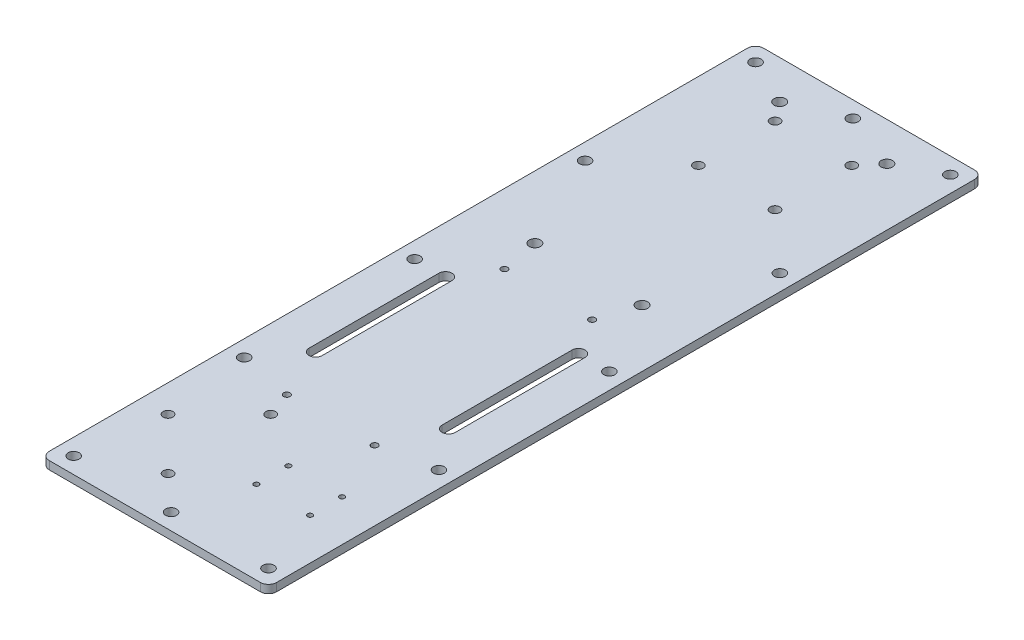
from build123d import *

# Parameters (mm, degrees)
PLATE_THICKNESS_DEPTH        = 3.175
SKETCH3_R                    = 2.159
MOUNTING_HOLES_DEPTH         = 147.635511132
SKETCH4_R                    = 2.2225
JETSON_HOLES_W_MOUNT_DEPTH   = 147.635511132
SKETCH5_R                    = 1.905
PDB_HOLES_DEPTH              = 147.635511132
SKETCH6_R                    = 1.905
LIDAR_HOLES_DEPTH            = 147.635511132
SKETCH7_R                    = 1.27
PIXHAWK_HOLES_DEPTH          = 147.635511132
BATTERY_HOLES_DEPTH          = 147.635511132
SKETCH9_R                    = 1
VENTRAL_BOARDCAM_HOLES_DEPTH = 147.635511132


with BuildPart() as part:
    # Sketch2 → Plate Thickness (new body)
    with BuildSketch(Plane(origin=(0, 0, 0), x_dir=(1, 0, 0), z_dir=(0, 1, 0))):
        with BuildLine():
            Line((-41.275, 139.7), (41.275, 139.7))
            ThreePointArc((41.275, 139.7), (43.52006403, 138.77006403), (44.45, 136.525))
            Line((44.45, 136.525), (44.45, -136.525))
            ThreePointArc((44.45, -136.525), (43.52006403, -138.77006403), (41.275, -139.7))
            Line((41.275, -139.7), (-41.275, -139.7))
            ThreePointArc((-41.275, -139.7), (-43.52006403, -138.77006403), (-44.45, -136.525))
            Line((-44.45, -136.525), (-44.45, 136.525))
            ThreePointArc((-44.45, 136.525), (-43.52006403, 138.77006403), (-41.275, 139.7))
        make_face()
    extrude(amount=PLATE_THICKNESS_DEPTH)

    # Sketch3 → Mounting holes (cut, through all)
    with BuildSketch(Plane(origin=(0, 3.175, 0), x_dir=(1, 0, 0), z_dir=(0, 1, 0))):
        with Locations((-38.1, 133.35)):
            Circle(SKETCH3_R)
        with Locations((-38.1, 66.675)):
            Circle(SKETCH3_R)
        with Locations((-38.1, -66.675)):
            Circle(SKETCH3_R)
        with Locations((-38.1, -133.35)):
            Circle(SKETCH3_R)
        with Locations((38.1, -133.35)):
            Circle(SKETCH3_R)
        with Locations((38.1, -66.675)):
            Circle(SKETCH3_R)
        with Locations((38.1, 66.675)):
            Circle(SKETCH3_R)
        with Locations((38.1, 133.35)):
            Circle(SKETCH3_R)
        with Locations((0, 133.35)):
            Circle(SKETCH3_R)
        with Locations((0, -133.35)):
            Circle(SKETCH3_R)
        with Locations((-38.1, 0)):
            Circle(SKETCH3_R)
        with Locations((38.1, 0)):
            Circle(SKETCH3_R)
    extrude(amount=-MOUNTING_HOLES_DEPTH, mode=Mode.SUBTRACT)

    # Sketch4 → Jetson Holes (w/ mount) (cut, through all)
    with BuildSketch(Plane(origin=(0, 3.175, 0), x_dir=(1, 0, 0), z_dir=(0, 1, 0))):
        with Locations((-19.937372124, 124.652240808)):
            Circle(SKETCH4_R)
        with Locations((-19.937372124, 28.894240808)):
            Circle(SKETCH4_R)
        with Locations((21.972627876, 28.894240808)):
            Circle(SKETCH4_R)
        with Locations((21.972627876, 124.652240808)):
            Circle(SKETCH4_R)
    extrude(amount=-JETSON_HOLES_W_MOUNT_DEPTH, mode=Mode.SUBTRACT)

    # Sketch5 → PDB holes (cut, through all)
    with BuildSketch(Plane(origin=(0, 3.175, 0), x_dir=(1, 0, 0), z_dir=(0, 1, 0))):
        with Locations((-14.341868752, 117.235149692)):
            Circle(SKETCH5_R)
        with Locations((15.655531248, 117.235149692)):
            Circle(SKETCH5_R)
        with Locations((15.655531248, 87.237749692)):
            Circle(SKETCH5_R)
        with Locations((-14.341868752, 87.237749692)):
            Circle(SKETCH5_R)
    extrude(amount=-PDB_HOLES_DEPTH, mode=Mode.SUBTRACT)

    # Sketch6 → Lidar Holes (cut, through all)
    with BuildSketch(Plane(origin=(0, 3.175, 0), x_dir=(1, 0, 0), z_dir=(0, 1, 0))):
        with Locations((-13.662214462, -120.878432291)):
            Circle(SKETCH6_R)
        with Locations((-13.662214462, -80.746432291)):
            Circle(SKETCH6_R)
        with Locations((-33.728214462, -100.812432291)):
            Circle(SKETCH6_R)
    extrude(amount=-LIDAR_HOLES_DEPTH, mode=Mode.SUBTRACT)

    # Sketch7 → PixHawk Holes (cut, through all)
    with BuildSketch(Plane(origin=(0, 3.175, 0), x_dir=(1, 0, 0), z_dir=(0, 1, 0))):
        with Locations((-17.145, 14.172396373)):
            Circle(SKETCH7_R)
        with Locations((-17.145, -70.917603627)):
            Circle(SKETCH7_R)
        with Locations((17.145, -70.917603627)):
            Circle(SKETCH7_R)
        with Locations((17.145, 14.172396373)):
            Circle(SKETCH7_R)
    extrude(amount=-PIXHAWK_HOLES_DEPTH, mode=Mode.SUBTRACT)

    # Sketch8 → Battery Holes (cut, through all)
    with BuildSketch(Plane(origin=(0, 3.175, 0), x_dir=(1, 0, 0), z_dir=(0, 1, 0))):
        with BuildLine():
            Line((-23.495, -0.005964701), (-23.495, -50.805964701))
            ThreePointArc((-23.495, -50.805964701), (-26.035, -53.345964701), (-28.575, -50.805964701))
            Line((-28.575, -50.805964701), (-28.575, -0.005964701))
            ThreePointArc((-28.575, -0.005964701), (-26.035, 2.534035299), (-23.495, -0.005964701))
        make_face()
        with BuildLine():
            Line((23.495, -0.005964701), (23.495, -50.805964701))
            ThreePointArc((23.495, -50.805964701), (26.035, -53.345964701), (28.575, -50.805964701))
            Line((28.575, -50.805964701), (28.575, -0.005964701))
            ThreePointArc((28.575, -0.005964701), (26.035, 2.534035299), (23.495, -0.005964701))
        make_face()
    extrude(amount=-BATTERY_HOLES_DEPTH, mode=Mode.SUBTRACT)

    # Sketch9 → Ventral Boardcam Holes (cut, through all)
    with BuildSketch(Plane.XZ):
        with Locations((7.243059032, 107.226883851)):
            Circle(SKETCH9_R)
        with Locations((28.243059032, 107.226883851)):
            Circle(SKETCH9_R)
        with Locations((7.243059032, 94.726883851)):
            Circle(SKETCH9_R)
        with Locations((28.243059032, 94.726883851)):
            Circle(SKETCH9_R)
    extrude(amount=-VENTRAL_BOARDCAM_HOLES_DEPTH, mode=Mode.SUBTRACT)


solid = part.part
